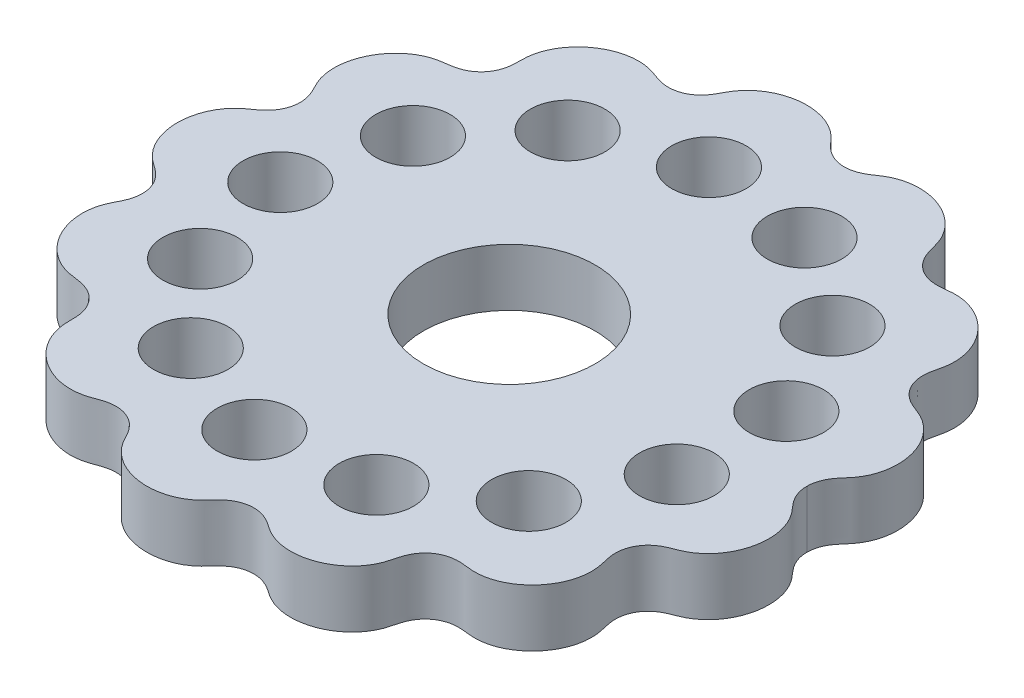
from build123d import *

# Parameters (mm, degrees)
BOSS_EXTRUDE4_DEPTH = 6.35
SKETCH8_R           = 9.525
CUT_EXTRUDE3_DEPTH  = 53.31876846
SKETCH9_R           = 4.1275
CUT_EXTRUDE4_DEPTH  = 6.35
CIRPATTERN1_COUNT   = 13


# Read off the part's stored shape, not the designer's step: Boss-Extrude4
with BuildPart() as part:
    # Boss-Extrude4 outline → Boss-Extrude4 (new body)
    with BuildSketch(Plane(origin=(0, 0, 0), x_dir=(1, 0, 0), z_dir=(0, 1, 0))):
        with BuildLine():
            add(Edge.make_bspline(
                [(33.02, 1e-09), (33.02, -0.028569545), (33.02084591, -0.085602372), (33.024652497, -0.191928061), (33.034791909, -0.336933306), (33.053767506, -0.505148773), (33.081087528, -0.667986255), (33.116635321, -0.833354939), (33.16895401, -1.028391212), (33.230787256, -1.220411287), (33.34074908, -1.502737608), (33.551297993, -1.921400759), (33.833545595, -2.336739038), (34.180207981, -2.740794967), (34.509172734, -3.113300088), (34.759969503, -3.422180377), (35.04816791, -3.827616447), (35.314387338, -4.289324664), (35.546246129, -4.807842722), (35.775266209, -5.508131852), (35.93646468, -6.29968602), (35.997311797, -7.241458324), (35.897776012, -8.323055588), (35.631127311, -9.384066692), (35.199720168, -10.398295147), (34.606640309, -11.336890624), (33.920924623, -12.09881217), (33.187387158, -12.683851874), (32.530183083, -13.057004525), (32.003197611, -13.281605075), (31.468140515, -13.484115603), (30.858806422, -13.734178301), (30.132594439, -14.16959406), (29.424548667, -14.905839862), (28.939293331, -15.883827567), (28.774129661, -16.890153597), (28.851763993, -17.725592677), (29.00961097, -18.381930451), (29.13031298, -18.88516253), (29.206011083, -19.292527301), (29.264847918, -19.80713939), (29.274602179, -20.483319706), (29.175248372, -21.312923461), (28.904072894, -22.268811068), (28.463458684, -23.218740411), (27.882581694, -24.094427152), (27.175325398, -24.876954791), (26.355800189, -25.547459244), (25.439248497, -26.086124173), (24.516153406, -26.443775098), (23.714658161, -26.616118347), (23.068208789, -26.668619094), (22.589502544, -26.663752087), (22.20764006, -26.635864574), (21.732417454, -26.580825544), (21.088844542, -26.507649024), (20.265915788, -26.524434117), (19.290090435, -26.79665519), (18.364629833, -27.393546557), (17.772435284, -28.110307734), (17.440328216, -28.782286352), (17.260893505, -29.317096024), (17.161050458, -29.686037164), (17.069862643, -30.056988861), (16.9684575, -30.425492489), (16.815887924, -30.878367496), (16.550025598, -31.482495826), (16.10919201, -32.202055563), (15.436523232, -32.977467335), (14.576346403, -33.682219839), (13.621810755, -34.234865084), (12.601282814, -34.629189142), (11.540801903, -34.860081222), (10.465681972, -34.922924477), (9.463634187, -34.817504649), (8.655248803, -34.598060579), (8.041068422, -34.339169756), (7.603676767, -34.103752008), (7.266747625, -33.89322217), (6.857488983, -33.612466299), (6.304749391, -33.241251388), (5.545549288, -32.877669941), (4.543154151, -32.687477733), (3.45770191, -32.81173826), (2.523041534, -33.224900338), (1.864896544, -33.754262976), (1.412712006, -34.245922078), (1.082367413, -34.61818249), (0.806404491, -34.905583436), (0.439231573, -35.242241327), (-0.094088718, -35.645285588), (-0.826299851, -36.057284206), (-1.775178919, -36.405127424), (-2.83647996, -36.606398714), (-3.922910211, -36.639907105), (-5.00856144, -36.504936727), (-6.06706679, -36.201036889), (-6.944500593, -35.787364221), (-7.638296252, -35.331315972), (-8.2063563, -34.851871145), (-8.595887776, -34.44559032), (-8.915808743, -34.035856766), (-9.174156459, -33.635495884), (-9.361916942, -33.303883471), (-9.583163729, -32.882326664), (-9.835478391, -32.428363002), (-10.162872902, -31.968591199), (-10.683374196, -31.434803492), (-11.363827121, -30.968784266), (-12.265533699, -30.644443767), (-13.287100477, -30.598633408), (-14.108064228, -30.775295089), (-14.736235417, -31.007924003), (-15.21082279, -31.18514901), (-15.597102217, -31.308603217), (-16.089367512, -31.429974944), (-16.753264628, -31.52664519), (-17.589168145, -31.535880865), (-18.578143628, -31.38897852), (-19.589471818, -31.067469474), (-20.542351492, -30.593776243), (-21.415639986, -29.980269678), (-22.188546892, -29.239428129), (-22.838982728, -28.384757317), (-23.303978527, -27.507055575), (-23.598045225, -26.644664535), (-23.727807394, -25.920625756), (-23.76388255, -25.362062409), (-23.767572786, -24.803046211), (-23.770961455, -24.162615123), (-23.860937744, -23.482576308), (-24.102002096, -22.795277323), (-24.512377741, -22.098386306), (-25.058247987, -21.492100381), (-25.714941989, -21.057554795), (-26.415691553, -20.798100924), (-26.9766824, -20.676182536), (-27.377014453, -20.616941001), (-27.778487366, -20.568881066), (-28.178678809, -20.509124354), (-28.673571579, -20.403997213), (-29.318154733, -20.201103552), (-30.083779582, -19.838991887), (-30.920136753, -19.260747251), (-31.698467014, -18.505934718), (-32.347297922, -17.640445981), (-32.855146743, -16.688003235), (-33.21132155, -15.671381081), (-33.405196114, -14.613678689), (-33.423766267, -13.607802753), (-33.305931579, -12.779743552), (-33.125333542, -12.139194878), (-32.946140186, -11.676632962), (-32.779038062, -11.316879431), (-32.550474822, -10.876966302), (-32.247518401, -10.285494373), (-31.974142357, -9.490529231), (-31.902259682, -8.507413507), (-32.121420452, -7.506405246), (-32.648720008, -6.528452622), (-33.377020338, -5.805788562), (-34.187310346, -5.306591477), (-34.91403454, -4.718035659), (-35.457906988, -4.132130806), (-35.936516673, -3.440812895), (-36.280942508, -2.749291792), (-36.507866707, -2.128902872), (-36.645065322, -1.619495984), (-36.724766431, -1.234417735), (-36.773346433, -0.909472766), (-36.801317876, -0.651242256), (-36.817450514, -0.437668065), (-36.826055751, -0.252660371), (-36.829282873, -0.111408173), (-36.83, -0.03691506), (-36.83, 0)],
                knots=[0.075067642, 0.075067642, 0.075067642, 0.075067642, 0.075067642, 0.075982609, 0.076897577, 0.077812544, 0.078727511, 0.080557445, 0.081472412, 0.082387379, 0.084217314, 0.086047248, 0.089707116, 0.095116829, 0.097821685, 0.100526541, 0.103231397, 0.105936253, 0.111345965, 0.114998942, 0.11865192, 0.125957875, 0.13326383, 0.140569784, 0.148088657, 0.15560753, 0.163126402, 0.170645275, 0.175835283, 0.181025291, 0.183620295, 0.186215299, 0.191405307, 0.198935818, 0.206466329, 0.213565324, 0.220664318, 0.226296867, 0.229113142, 0.231929416, 0.23474569, 0.237561965, 0.243194513, 0.2502894, 0.257384287, 0.264479174, 0.271574061, 0.278775943, 0.285977825, 0.293179707, 0.30038159, 0.30558801, 0.30819122, 0.310794431, 0.313397641, 0.316000851, 0.321207271, 0.328418331, 0.335629391, 0.343171085, 0.350712779, 0.353311673, 0.355910567, 0.358509461, 0.361108355, 0.363707249, 0.366306143, 0.371503931, 0.379034028, 0.386564124, 0.39409422, 0.401624316, 0.408919329, 0.416214343, 0.423509357, 0.430804371, 0.436206316, 0.438907288, 0.441608261, 0.444309233, 0.447010205, 0.45241215, 0.459719973, 0.467027797, 0.474359265, 0.481690734, 0.487108332, 0.48981713, 0.492525929, 0.495234728, 0.497943527, 0.503361124, 0.510677993, 0.517994862, 0.52531173, 0.532628599, 0.540136204, 0.547643809, 0.555151414, 0.558905216, 0.562659018, 0.567841349, 0.570432514, 0.57302368, 0.575614845, 0.57820601, 0.583388341, 0.587147919, 0.590907496, 0.598426652, 0.605624024, 0.612821396, 0.618334902, 0.621091655, 0.623848409, 0.626605162, 0.629361915, 0.634875421, 0.642064791, 0.64925416, 0.65644353, 0.6636329, 0.670908397, 0.678183895, 0.685459392, 0.69273489, 0.697804986, 0.702875081, 0.705410129, 0.707945177, 0.713015273, 0.720302641, 0.723946325, 0.72759001, 0.734944803, 0.742299596, 0.745050752, 0.747801907, 0.750553063, 0.753304218, 0.756055373, 0.758806529, 0.764308839, 0.771652419, 0.778995999, 0.786339579, 0.793683158, 0.800967208, 0.808251257, 0.815535306, 0.822819355, 0.828213656, 0.830910807, 0.833607958, 0.836305109, 0.839002259, 0.844396561, 0.851692283, 0.858988006, 0.865439747, 0.871891488, 0.881591704, 0.886441812, 0.89129192, 0.897276313, 0.903260706, 0.909245099, 0.912237295, 0.915229492, 0.917593972, 0.919958452, 0.921140693, 0.922322933, 0.923505173, 0.924687413, 0.924687413, 0.924687413, 0.924687413, 0.924687413], degree=4))
            Line((33.02, 1e-09), (-36.83, 0))
        make_face()
    boss_extrude4 = extrude(amount=BOSS_EXTRUDE4_DEPTH)

    # Mirror1: Boss-Extrude4 across plane
    add(boss_extrude4.mirror(Plane(origin=(0, 6.35, 0), x_dir=(1, 0, 0), z_dir=(0, 0, -1))))

    # Sketch8 → Cut-Extrude3 (cut, through all)
    with BuildSketch(Plane(origin=(0, 0, 0), x_dir=(1, 0, 0), z_dir=(0, 1, 0))):
        with Locations(Location((0, 0, 0), (0, 0, 270))):
            Circle(SKETCH8_R)
    extrude(amount=CUT_EXTRUDE3_DEPTH, mode=Mode.SUBTRACT)

    # Sketch9 → Cut-Extrude4 (cut)
    with BuildSketch(Plane(origin=(0, 6.35, 0), x_dir=(1, 0, 0), z_dir=(0, 1, 0))):
        with Locations(Location((-25.4, 0, 0), (0, 0, 270))):
            Circle(SKETCH9_R)
    cut_extrude4 = extrude(amount=-CUT_EXTRUDE4_DEPTH, mode=Mode.SUBTRACT)

    # CirPattern1: Cut-Extrude4 ×13 about axis
    cirpattern1_axis = Axis((0, 0, 0), (0, 1, 0))
    for i in range(1, CIRPATTERN1_COUNT):
        add(cut_extrude4.rotate(cirpattern1_axis, i * 360 / CIRPATTERN1_COUNT), mode=Mode.SUBTRACT)


solid = part.part
